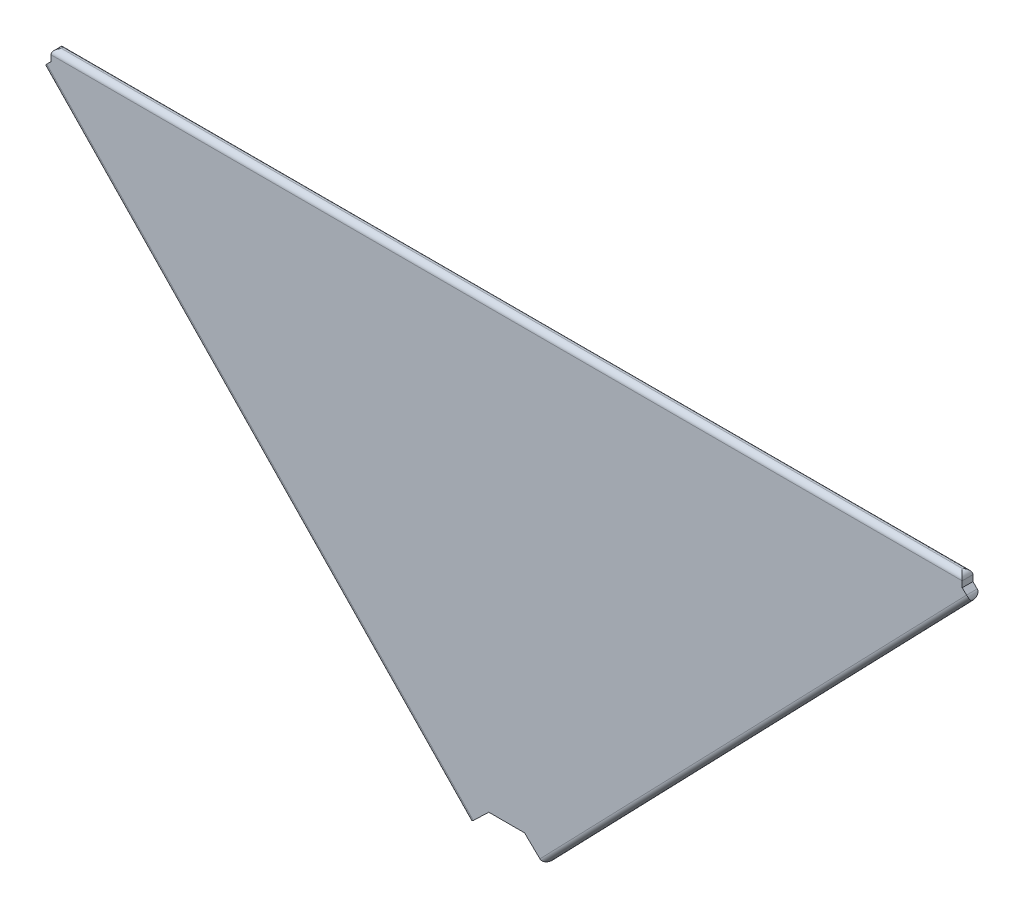
from build123d import *

# Parameters (mm, degrees)
EXTRUDE_1_DEPTH = 0.2
FILLET_1_R      = 0.1


with BuildPart() as part:
    # 草图1 → 凸台-拉伸1 (new body)
    with BuildSketch(Plane.XY):
        Polygon((17.561117632, 0), (0.5, 0), (0.5, -0.212237408), (0.347329185, -0.3596699), (8.335900446, -8.632077604), (8.695570346, -8.284748419), (9.365547286, -8.284748419), (9.725217186, -8.632077604), (17.713788447, -0.3596699), (17.561117632, -0.212237408), align=None)
    extrude(amount=EXTRUDE_1_DEPTH)

    # 圆角1
    fillet_1_edges = [part.edges().sort_by_distance(p)[0] for p in [
        (4.341614815, -4.495873752, 0),
        (9.030558816, 0, 0),
        (13.719502817, -4.495873752, 0),
        (13.719502817, -4.495873752, 0.2),
        (8.335900446, -8.632077604, 0.1),
        (0.347329185, -0.3596699, 0.1),
        (0.5, 0, 0.1),
        (17.561117632, 0, 0.1),
        (17.713788447, -0.3596699, 0.1),
        (9.725217186, -8.632077604, 0.1),
        (9.030558816, 0, 0.2),
        (4.341614815, -4.495873752, 0.2),
    ]]
    fillet(fillet_1_edges, radius=FILLET_1_R - 0.0001)  # a hair under: the kernel refuses the full size


solid = part.part
